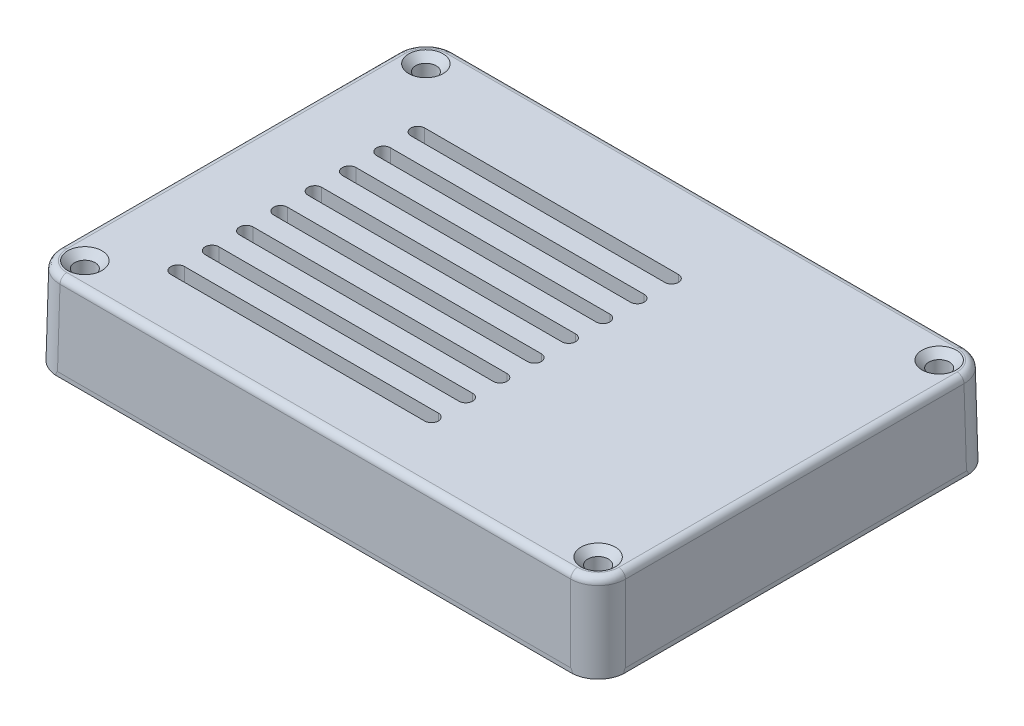
from build123d import *
from OCP.BRepFilletAPI import BRepFilletAPI_MakeChamfer

# Parameters (mm, degrees)
SKETCH1_W               = 82.8
SKETCH1_H               = 57.7
BOSS_EXTRUDE1_DEPTH     = 12.6
CHAMFER1_SIZE           = 12
CHAMFER1_SIZE2          = 0.2
FILLET1_R               = 4
SKETCH2_R               = 1.5
CUT_EXTRUDE1_DEPTH      = 12.6
FILLET2_R               = 1
CHAMFER2_SIZE           = 1
CUT_EXTRUDE2_DEPTH      = 10.4
CUT_EXTRUDE_THIN1_DEPTH = 1
CUT_EXTRUDE3_DEPTH      = 10.4


with BuildPart() as part:
    # Sketch1 → Boss-Extrude1 (new body)
    with BuildSketch(Plane(origin=(0, 0, 0), x_dir=(1, 0, 0), z_dir=(0, 1, 0))):
        with Locations((-67.329666271, 2.285365627)):
            Rectangle(SKETCH1_W, SKETCH1_H)
    extrude(amount=BOSS_EXTRUDE1_DEPTH)

    # Chamfer1: one chamfer whose edges measure the first distance from different faces: ONE call of the kernel's chamfer builder (chamfer() names one face for all edges)
    chamfer1_edges_1 = [part.edges().sort_by_distance(p)[0] for p in [
        (-108.729666271, 12.6, -2.285365627),
    ]]
    chamfer1_side_1 = [part.faces().sort_by_distance(p)[0] for p in [
        (-108.729666271, 6.3, -2.285365627),
    ]]
    chamfer1_edges_2 = [part.edges().sort_by_distance(p)[0] for p in [
        (-67.329666271, 12.6, 26.564634373),
    ]]
    chamfer1_side_2 = [part.faces().sort_by_distance(p)[0] for p in [
        (-67.329666271, 6.3, 26.564634373),
    ]]
    chamfer1_edges_3 = [part.edges().sort_by_distance(p)[0] for p in [
        (-25.929666271, 12.6, -2.285365627),
    ]]
    chamfer1_side_3 = [part.faces().sort_by_distance(p)[0] for p in [
        (-25.929666271, 6.3, -2.285365627),
    ]]
    chamfer1_edges_4 = [part.edges().sort_by_distance(p)[0] for p in [
        (-67.329666271, 12.6, -31.135365627),
    ]]
    chamfer1_side_4 = [part.faces().sort_by_distance(p)[0] for p in [
        (-67.329666271, 6.3, -31.135365627),
    ]]
    chamfer1 = BRepFilletAPI_MakeChamfer(part.part.solid().wrapped)
    for e in chamfer1_edges_1:
        chamfer1.Add(CHAMFER1_SIZE, CHAMFER1_SIZE2, e.wrapped, chamfer1_side_1[0].wrapped)  # the first distance lies on this face
    for e in chamfer1_edges_2:
        chamfer1.Add(CHAMFER1_SIZE, CHAMFER1_SIZE2, e.wrapped, chamfer1_side_2[0].wrapped)  # the first distance lies on this face
    for e in chamfer1_edges_3:
        chamfer1.Add(CHAMFER1_SIZE, CHAMFER1_SIZE2, e.wrapped, chamfer1_side_3[0].wrapped)  # the first distance lies on this face
    for e in chamfer1_edges_4:
        chamfer1.Add(CHAMFER1_SIZE, CHAMFER1_SIZE2, e.wrapped, chamfer1_side_4[0].wrapped)  # the first distance lies on this face
    add(Compound.cast(chamfer1.Shape()), mode=Mode.REPLACE)

    # Fillet1
    # the kernel refuses this fillet: 4 mm, written as the material it takes off along each edge
    with BuildSketch(Plane(origin=(-108.896240397, -9.394447529, -31.301939752), x_dir=(0.9998611785930702, -0.016659725275086107, -0.0002776620879181018), z_dir=(0.016662038965156993, 0.9997223379094053, 0.016662038965156698)), Plane(origin=(-108.896240397, -9.394447529, 26.731208499), x_dir=(-0.0002776620879180821, -0.016659725275085812, -0.9998611785930703), z_dir=(0.016662038965156993, 0.9997223379094053, -0.016662038965156698))) as fillet1_piece_1:
        with BuildLine():
            CenterArc((FILLET1_R * 0.999722337909, -FILLET1_R), FILLET1_R, 90, 89.984088925)
            Line((-FILLET1_R * 0.000277623531772, -FILLET1_R * 0.999722299361), (0, 0))
            Line((0, 0), (FILLET1_R * 0.999722337909, 0))
        make_face()
    extrude(amount=31.997779629, mode=Mode.SUBTRACT)
    with BuildSketch(Plane(origin=(-25.763092146, -9.394447529, -31.301939752), x_dir=(-0.9998611785930702, -0.016659725275085812, -0.0002776620879180895), z_dir=(-0.016662038965156698, 0.9997223379094053, 0.016662038965156698)), Plane(origin=(-25.763092146, -9.394447529, 26.731208499), x_dir=(0.0002776620879180895, -0.016659725275085812, -0.9998611785930703), z_dir=(-0.016662038965156698, 0.9997223379094053, -0.016662038965156698))) as fillet1_piece_2:
        with BuildLine():
            CenterArc((FILLET1_R * 0.999722337909, FILLET1_R), FILLET1_R, 180.015911075, 89.984088925)
            Line((-FILLET1_R * 0.000277623531773, FILLET1_R * 0.999722299361), (0, 0))
            Line((0, 0), (FILLET1_R * 0.999722337909, 0))
        make_face()
    extrude(amount=31.997779629, mode=Mode.SUBTRACT)

    # Sketch2 → Cut-Extrude1 (cut)
    with BuildSketch(Plane.XZ):
        with Locations(Location((-104.739110754, 22.574078856, 0), (0, 0, 270))):
            Circle(SKETCH2_R)
        with Locations(Location((-29.920221788, 22.574078856, 0), (0, 0, 270))):
            Circle(SKETCH2_R)
        with Locations(Location((-104.739110754, -27.14481011, 0), (0, 0, 270))):
            Circle(SKETCH2_R)
        with Locations(Location((-29.920221788, -27.14481011, 0), (0, 0, 270))):
            Circle(SKETCH2_R)
    extrude(amount=-CUT_EXTRUDE1_DEPTH, mode=Mode.SUBTRACT)

    # Fillet2
    fillet2_edges = [part.edges().sort_by_distance(p)[0] for p in [
        (-67.329666271, 12.6, -30.935365627),
        (-67.329666271, 12.6, 26.364634373),
        (-26.129666271, 12.6, -2.285365627),
        (-108.529666271, 12.6, -2.285365627),
        (-107.358323444, 12.6, 25.193291546),
        (-27.301009098, 12.6, 25.193291546),
        (-27.301009098, 12.6, -29.7640228),
        (-107.358323444, 12.6, -29.7640228),
    ]]
    fillet(fillet2_edges, radius=FILLET2_R)

    # Chamfer2
    chamfer2_edges = [part.edges().sort_by_distance(p)[0] for p in [
        (-104.739110754, 12.6, 24.074078856),
        (-29.920221788, 12.6, 24.074078856),
        (-104.739110754, 12.6, -25.64481011),
        (-29.920221788, 12.6, -25.64481011),
    ]]
    chamfer(chamfer2_edges, length=CHAMFER2_SIZE)

    # Sketch3 → Cut-Extrude2 (cut)
    with BuildSketch(Plane.XZ):
        with BuildLine():
            Line((-99.765131832, 22.064634373), (-34.89420071, 22.064634373))
            ThreePointArc((-34.89420071, 22.064634373), (-33.455755694, 19.03854495), (-30.429666271, 17.600099934))
            Line((-30.429666271, 17.600099934), (-30.429666271, -22.170831188))
            ThreePointArc((-30.429666271, -22.170831188), (-33.455755694, -23.609276204), (-34.89420071, -26.635365627))
            Line((-34.89420071, -26.635365627), (-99.765131832, -26.635365627))
            ThreePointArc((-99.765131832, -26.635365627), (-101.203576848, -23.609276204), (-104.229666271, -22.170831188))
            Line((-104.229666271, -22.170831188), (-104.229666271, 17.600099934))
            ThreePointArc((-104.229666271, 17.600099934), (-101.203576848, 19.03854495), (-99.765131832, 22.064634373))
        make_face()
    extrude(amount=-CUT_EXTRUDE2_DEPTH, mode=Mode.SUBTRACT)

    # Sketch3<4> → Cut-Extrude-Thin1 (cut)
    with BuildSketch(Plane.XZ):
        with BuildLine():
            Line((-102.135604608, 24.064634373), (-32.523727934, 24.064634373))
            ThreePointArc((-32.523727934, 24.064634373), (-32.041542132, 20.452758513), (-28.429666271, 19.97057271))
            Line((-28.429666271, 19.97057271), (-28.429666271, -24.541303964))
            ThreePointArc((-28.429666271, -24.541303964), (-32.041542132, -25.023489766), (-32.523727934, -28.635365627))
            Line((-32.523727934, -28.635365627), (-102.135604608, -28.635365627))
            ThreePointArc((-102.135604608, -28.635365627), (-102.617790411, -25.023489766), (-106.229666271, -24.541303964))
            Line((-106.229666271, -24.541303964), (-106.229666271, 19.97057271))
            ThreePointArc((-106.229666271, 19.97057271), (-102.617790411, 20.452758513), (-102.135604608, 24.064634373))
        make_face()
        with BuildLine():
            Line((-100.769305307, 23.064634373), (-33.890027235, 23.064634373))
            ThreePointArc((-33.890027235, 23.064634373), (-32.748648913, 19.745651731), (-29.429666271, 18.604273409))
            Line((-29.429666271, 18.604273409), (-29.429666271, -23.175004663))
            ThreePointArc((-29.429666271, -23.175004663), (-32.748648913, -24.316382985), (-33.890027235, -27.635365627))
            Line((-33.890027235, -27.635365627), (-100.769305307, -27.635365627))
            ThreePointArc((-100.769305307, -27.635365627), (-101.910683629, -24.316382985), (-105.229666271, -23.175004663))
            Line((-105.229666271, -23.175004663), (-105.229666271, 18.604273409))
            ThreePointArc((-105.229666271, 18.604273409), (-101.910683629, 19.745651731), (-100.769305307, 23.064634373))
        make_face(mode=Mode.SUBTRACT)
    extrude(amount=-CUT_EXTRUDE_THIN1_DEPTH, mode=Mode.SUBTRACT)

    # Sketch4 → Cut-Extrude3 (cut)
    with BuildSketch(Plane(origin=(0, 12.6, 0), x_dir=(1, 0, 0), z_dir=(0, 1, 0))):
        with BuildLine():
            Line((-96.729666271, 18.951893414), (-59.729666271, 18.951893414))
            ThreePointArc((-59.729666271, 18.951893414), (-58.729666271, 17.951893414), (-59.729666271, 16.951893414))
            Line((-59.729666271, 16.951893414), (-96.729666271, 16.951893414))
            ThreePointArc((-96.729666271, 16.951893414), (-97.729666271, 17.951893414), (-96.729666271, 18.951893414))
        make_face()
        with BuildLine():
            Line((-96.729666271, 13.951893414), (-59.729666271, 13.951893414))
            ThreePointArc((-59.729666271, 13.951893414), (-58.729666271, 12.951893414), (-59.729666271, 11.951893414))
            Line((-59.729666271, 11.951893414), (-96.729666271, 11.951893414))
            ThreePointArc((-96.729666271, 11.951893414), (-97.729666271, 12.951893414), (-96.729666271, 13.951893414))
        make_face()
        with BuildLine():
            Line((-96.729666271, 8.951893414), (-59.729666271, 8.951893414))
            ThreePointArc((-59.729666271, 8.951893414), (-58.729666271, 7.951893414), (-59.729666271, 6.951893414))
            Line((-59.729666271, 6.951893414), (-96.729666271, 6.951893414))
            ThreePointArc((-96.729666271, 6.951893414), (-97.729666271, 7.951893414), (-96.729666271, 8.951893414))
        make_face()
        with BuildLine():
            Line((-96.729666271, 3.951893414), (-59.729666271, 3.951893414))
            ThreePointArc((-59.729666271, 3.951893414), (-58.729666271, 2.951893414), (-59.729666271, 1.951893414))
            Line((-59.729666271, 1.951893414), (-96.729666271, 1.951893414))
            ThreePointArc((-96.729666271, 1.951893414), (-97.729666271, 2.951893414), (-96.729666271, 3.951893414))
        make_face()
        with BuildLine():
            Line((-96.729666271, -1.048106586), (-59.729666271, -1.048106586))
            ThreePointArc((-59.729666271, -1.048106586), (-58.729666271, -2.048106586), (-59.729666271, -3.048106586))
            Line((-59.729666271, -3.048106586), (-96.729666271, -3.048106586))
            ThreePointArc((-96.729666271, -3.048106586), (-97.729666271, -2.048106586), (-96.729666271, -1.048106586))
        make_face()
        with BuildLine():
            Line((-96.729666271, -6.048106586), (-59.729666271, -6.048106586))
            ThreePointArc((-59.729666271, -6.048106586), (-58.729666271, -7.048106586), (-59.729666271, -8.048106586))
            Line((-59.729666271, -8.048106586), (-96.729666271, -8.048106586))
            ThreePointArc((-96.729666271, -8.048106586), (-97.729666271, -7.048106586), (-96.729666271, -6.048106586))
        make_face()
        with BuildLine():
            Line((-96.729666271, -11.048106586), (-59.729666271, -11.048106586))
            ThreePointArc((-59.729666271, -11.048106586), (-58.729666271, -12.048106586), (-59.729666271, -13.048106586))
            Line((-59.729666271, -13.048106586), (-96.729666271, -13.048106586))
            ThreePointArc((-96.729666271, -13.048106586), (-97.729666271, -12.048106586), (-96.729666271, -11.048106586))
        make_face()
        with BuildLine():
            Line((-96.729666271, -16.048106586), (-59.729666271, -16.048106586))
            ThreePointArc((-59.729666271, -16.048106586), (-58.729666271, -17.048106586), (-59.729666271, -18.048106586))
            Line((-59.729666271, -18.048106586), (-96.729666271, -18.048106586))
            ThreePointArc((-96.729666271, -18.048106586), (-97.729666271, -17.048106586), (-96.729666271, -16.048106586))
        make_face()
    extrude(amount=-CUT_EXTRUDE3_DEPTH, mode=Mode.SUBTRACT)


solid = part.part
